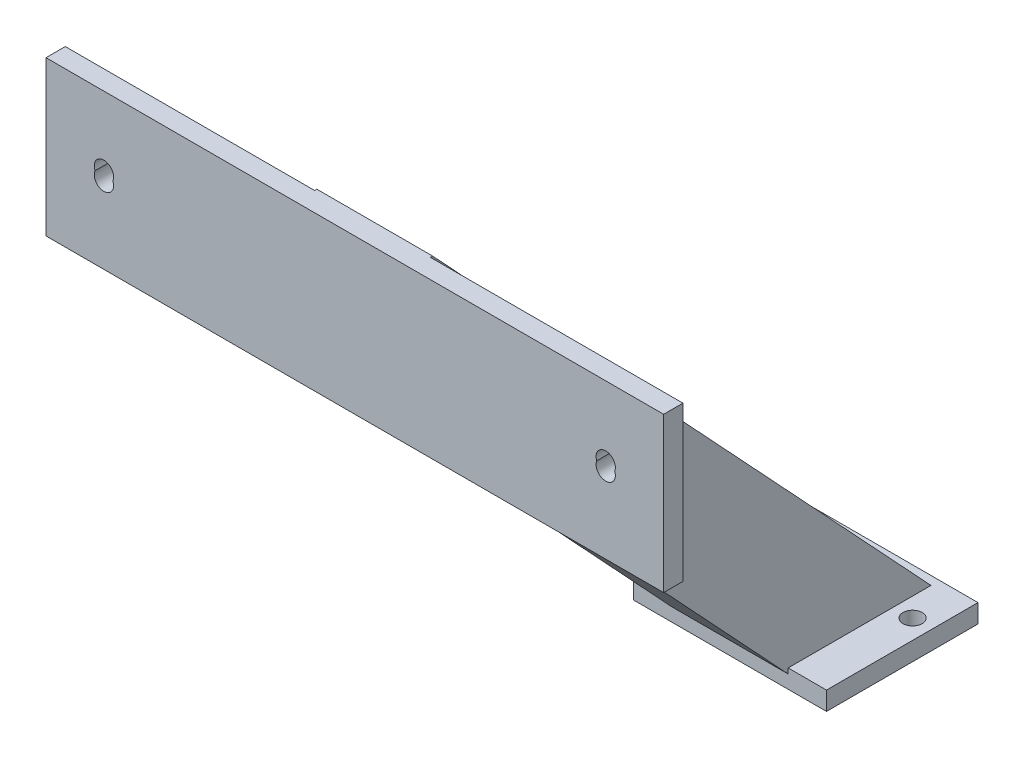
from build123d import *

# Parameters (mm, degrees)
SKETCH1_W               = 160
SKETCH1_H               = 40
BOSS_EXTRUDE1_DEPTH     = 5
SKETCH10_W              = 198.079975954
SKETCH10_H              = 30
BOSS_EXTRUDE3_DEPTH     = 14
CUT_EXTRUDE1_DEPTH      = 30
CUT_EXTRUDE4_DEPTH      = 211.957211927
SKETCH18_R              = 2.5
CUT_EXTRUDE5_DEPTH      = 205.997748991
CUT_EXTRUDE6_DEPTH      = 211.957211927
SKETCH20_W              = 50
SKETCH20_H              = 39.252056472
BOSS_EXTRUDE4_DEPTH     = 2.4
SKETCH21_R              = 2.5
CUT_EXTRUDE7_DEPTH      = 210.905831678
CUT_EXTRUDE9_DEPTH      = 1
CUT_EXTRUDE9_DEPTH_BACK = 1
SKETCH22_W              = 31.718044436
SKETCH22_H              = 7.429479552
CUT_EXTRUDE10_DEPTH     = 1
SKETCH15_R              = 2.5
CUT_EXTRUDE3_DEPTH      = 198.424865217


with BuildPart() as part:
    # Sketch1 → Boss-Extrude1 (new body)
    with BuildSketch(Plane.XY):
        with Locations((0.417519507, 5.949920674)):
            Rectangle(SKETCH1_W, SKETCH1_H)
    extrude(amount=BOSS_EXTRUDE1_DEPTH)

    # Sketch10 → Boss-Extrude3 (add, symmetric)
    with BuildSketch(Plane(origin=(0, 2.811339594, -3.014792614), x_dir=(0, -0.7313537016191695, -0.6819983600624997), z_dir=(0, 0.6819983600624997, -0.7313537016191695))):
        with Locations((75.491069918, 0)):
            Rectangle(SKETCH10_W, SKETCH10_H)
    extrude(amount=BOSS_EXTRUDE3_DEPTH, both=True)

    # Sketch12 → Cut-Extrude1 (cut)
    with BuildSketch(Plane.ZY.offset(15)):
        Polygon((5, -9.121756188), (20.705445577, 7.720272225), (2.806579061, 29.581905027), (-0.580301141, 25.949920674), (5, 25.949920674), align=None)
    extrude(amount=-CUT_EXTRUDE1_DEPTH, mode=Mode.SUBTRACT)


with BuildPart() as cut_extrude1_piece_1:
    # of the separate pieces the step leaves, piece 1, a body of its own (cut_extrude1_pieces)
    add(part.part.solids().sort_by_distance((-79.582480493, 25.949920674, 0))[0])

    # Sketch18 → Cut-Extrude5 (cut, through all)
    with BuildSketch(Plane(origin=(0, 0, 0), x_dir=(-1, 0, 0), z_dir=(0, 0, -1))):
        with Locations((-65.417519507, 7.738264691)):
            Circle(SKETCH18_R)
        with Locations((64.582480493, 7.969479132)):
            Circle(SKETCH18_R)
    extrude(amount=-CUT_EXTRUDE5_DEPTH, mode=Mode.SUBTRACT)

    # Sketch19 → Cut-Extrude6 (cut, through all)
    with BuildSketch(Plane(origin=(15, 0, 0), x_dir=(0, 0, -1), z_dir=(1, 0, 0))):
        Polygon((132.630964828, -114.903797371), (93.643349246, -114.903797371), (93.643349246, -140.259811882), (133.206173391, -140.259811882), (133.206173391, -115.172797329), align=None)
    extrude(amount=-CUT_EXTRUDE6_DEPTH, mode=Mode.SUBTRACT)

    # Sketch20 → Boss-Extrude4 (add, symmetric)
    with BuildSketch(Plane.XZ.offset(114.903797371)):
        with Locations((-0.068347329, -112.301206211)):
            Rectangle(SKETCH20_W, SKETCH20_H)
    extrude(amount=BOSS_EXTRUDE4_DEPTH, both=True)

    # Sketch21 → Cut-Extrude7 (cut, through all)
    with BuildSketch(Plane(origin=(0, -112.503797371, 0), x_dir=(1, 0, 0), z_dir=(0, 1, 0))):
        with Locations((19.931652671, 119.978116152)):
            Circle(SKETCH21_R)
        with Locations((-20.068347329, 119.90732933)):
            Circle(SKETCH21_R)
    extrude(amount=-CUT_EXTRUDE7_DEPTH, mode=Mode.SUBTRACT)

    # Sketch15 → Cut-Extrude3 (cut, through all)
    with BuildSketch(Plane.XY.offset(5)):
        with Locations((65.417519507, 5.949920674)):
            Circle(SKETCH15_R)
        with Locations((-64.582480493, 5.949920674)):
            Circle(SKETCH15_R)
    extrude(amount=-CUT_EXTRUDE3_DEPTH, mode=Mode.SUBTRACT)


with BuildPart() as cut_extrude1_piece_2:
    # of the separate pieces the step leaves, piece 2, a body of its own (cut_extrude1_pieces)
    add(part.part.solids().sort_by_distance((-15, 10.485950945, 23.284482706))[0])

    # Sketch17 → Cut-Extrude4 (cut, through all)
    with BuildSketch(Plane(origin=(15, 0, 0), x_dir=(0, 0, -1), z_dir=(1, 0, 0))):
        Polygon((-24.207278746, 10.985937934), (-20.561478453, 7.300935487), (-0.936880315, 30.864566028), align=None)
    extrude(amount=-CUT_EXTRUDE4_DEPTH, mode=Mode.SUBTRACT)

    # Sketch22 → Cut-Extrude9 (cut, two sides: drawn at the far end of the back side and taken through both)
    with BuildSketch(Plane(origin=(0, 17.222588392, 16.060323498), x_dir=(1, 0, 0), z_dir=(0, 0.7313537016191695, 0.6819983600624997)).offset(-CUT_EXTRUDE9_DEPTH_BACK)):
        with Locations((0.866687929, 15.637692298)):
            Rectangle(SKETCH22_W, SKETCH22_H)
    extrude(amount=CUT_EXTRUDE9_DEPTH + CUT_EXTRUDE9_DEPTH_BACK, mode=Mode.SUBTRACT)

    # Sketch23 → Cut-Extrude10 (cut)
    with BuildSketch(Plane.ZY.offset(15)):
        Polygon((2.081574676, 29.407475495), (7.191162477, 25.340141922), (3.657666435, 30.373467218), align=None)
    extrude(amount=-CUT_EXTRUDE10_DEPTH, mode=Mode.SUBTRACT)


solid = cut_extrude1_piece_1.part
